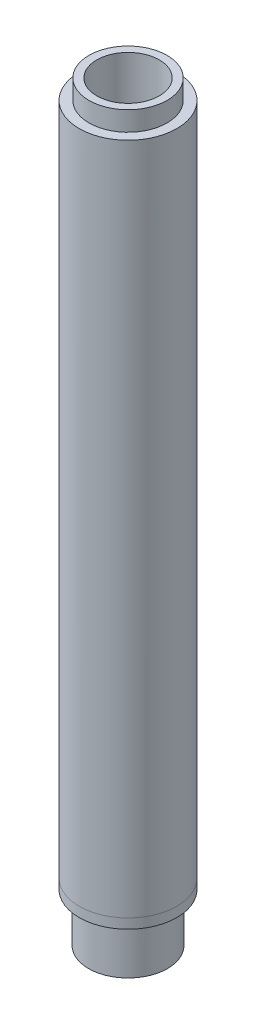
from build123d import *

# Parameters (mm, degrees)
SKETCH1_R           = 12.7
BOSS_EXTRUDE1_DEPTH = 177.8
SKETCH4_R           = 10.16
BOSS_EXTRUDE2_DEPTH = 5.08
SKETCH5_R           = 8.128
CUT_EXTRUDE1_DEPTH  = 184.759828036
SKETCH6_R           = 10.287
SKETCH6_R_2         = 8.128
BOSS_EXTRUDE3_DEPTH = 12.7


with BuildPart() as part:
    # Sketch1 → Boss-Extrude1 (new body)
    with BuildSketch(Plane(origin=(0, 0, 0), x_dir=(1, 0, 0), z_dir=(0, 1, 0))):
        Circle(SKETCH1_R)
    extrude(amount=BOSS_EXTRUDE1_DEPTH)

    # Sketch4 → Boss-Extrude2 (add)
    with BuildSketch(Plane(origin=(0, 177.8, 0), x_dir=(1, 0, 0), z_dir=(0, 1, 0))):
        Circle(SKETCH4_R)
    extrude(amount=BOSS_EXTRUDE2_DEPTH)

    # Sketch5 → Cut-Extrude1 (cut, through all)
    with BuildSketch(Plane(origin=(0, 182.88, 0), x_dir=(1, 0, 0), z_dir=(0, 1, 0))):
        Circle(SKETCH5_R)
    extrude(amount=-CUT_EXTRUDE1_DEPTH, mode=Mode.SUBTRACT)

    # Sketch6 → Boss-Extrude3 (add)
    with BuildSketch(Plane.XZ):
        Circle(SKETCH6_R)
        Circle(SKETCH6_R_2, mode=Mode.SUBTRACT)
    extrude(amount=BOSS_EXTRUDE3_DEPTH)


with BuildPart() as body_2:
    # Split1: the piece on the far side of the plane
    add(part.part)
    split(bisect_by=Plane(origin=(0, 2.54, 0), x_dir=(0, 0, -1), z_dir=(0, -1, 0)), keep=Keep.BOTTOM)


with BuildPart() as part_1:
    add(part.part)

    # Split1
    split(bisect_by=Plane(origin=(0, 2.54, 0), x_dir=(0, 0, -1), z_dir=(0, -1, 0)), keep=Keep.TOP)


solid = Compound([body_2.part, part_1.part])
